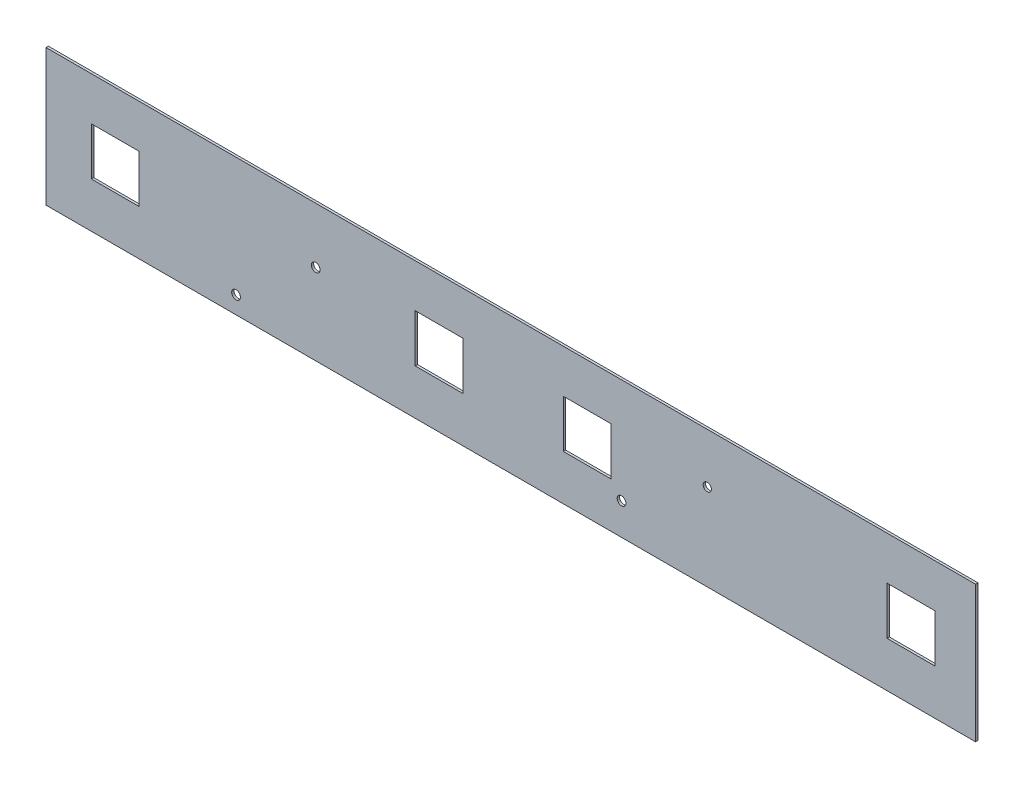
from build123d import *

# Parameters (mm, degrees)
SKETCH1_W           = 623.55984
SKETCH1_H           = 78.16342
BASE_FLANGE1_DEPTH  = 1.5875
SKETCH3_R           = 2.75
SKETCH3_R_2         = 2.921
SKETCH3_W           = 32.08
SKETCH3_H           = 32.08
CUT_EXTRUDE3_DEPTH  = 389.990867909
SKETCH6_W           = 623.55984
SKETCH6_H           = 13.4112
BOSS_EXTRUDE1_DEPTH = 1.5875


# Sheet-metal steps are written as plain solids
with BuildPart() as part:
    # Sketch1 → Base-Flange1 (new body)
    with BuildSketch(Plane.XY):
        with Locations((-38.857061865, -129.337653818)):
            Rectangle(SKETCH1_W, SKETCH1_H)
    extrude(amount=-BASE_FLANGE1_DEPTH)

    # Sketch3 → Cut-Extrude3 (cut, through all)
    with BuildSketch(Plane.XY):
        with Locations((92.914515529, -110.369060902)):
            Circle(SKETCH3_R)
        with Locations((35.391947046, -147.147547142)):
            Circle(SKETCH3_R_2)
        with Locations((-169.771284735, -114.165270711)):
            Circle(SKETCH3_R_2)
        with Locations((-223.149152531, -156.736460083)):
            Circle(SKETCH3_R_2)
        with Locations((-304.149901865, -121.952427932)):
            Rectangle(SKETCH3_W, SKETCH3_H)
        with Locations((-86.931641865, -121.952427932)):
            Rectangle(SKETCH3_W, SKETCH3_H)
        with Locations((12.392518135, -121.952427932)):
            Rectangle(SKETCH3_W, SKETCH3_H)
        with Locations((229.610778135, -121.952427932)):
            Rectangle(SKETCH3_W, SKETCH3_H)
    extrude(amount=-CUT_EXTRUDE3_DEPTH, mode=Mode.SUBTRACT)

    # Sketch6 → Boss-Extrude1 (add, through all)
    with BuildSketch(Plane.XY):
        with Locations((-38.857061865, -83.550343818)):
            Rectangle(SKETCH6_W, SKETCH6_H)
    extrude(amount=-BOSS_EXTRUDE1_DEPTH)


solid = part.part
